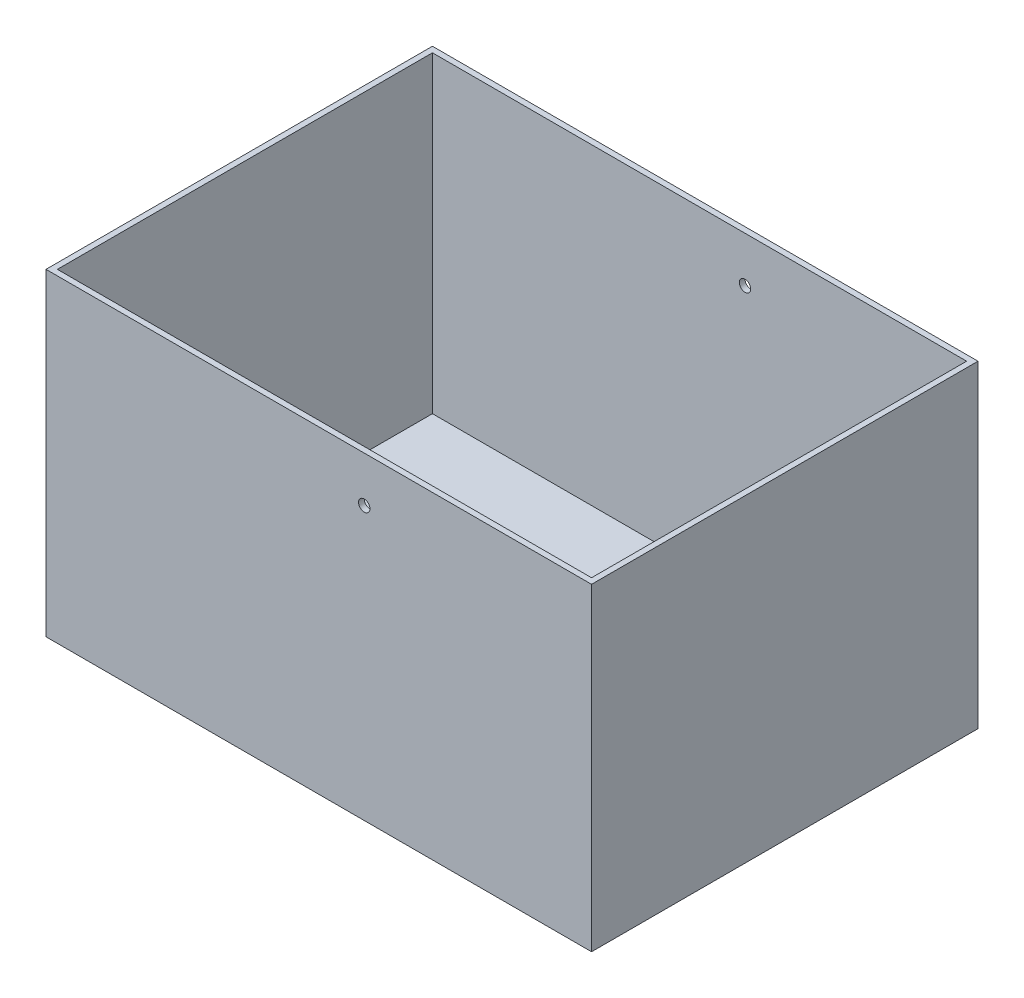
from build123d import *

# Parameters (mm, degrees)
SKETCH1_W               = 298.45
SKETCH1_H               = 209.55
BOSS_EXTRUDE1_DEPTH     = 3.175
SKETCH1_3_W             = 304.8
SKETCH1_3_H             = 215.9
SKETCH1_3_W_2           = 298.45
SKETCH1_3_H_2           = 209.55
BOSS_EXTRUDE2_DEPTH     = 177.8
CUT_EXTRUDE1_DEPTH      = 319.514379581
CUT_EXTRUDE1_DEPTH_BACK = 319.514379581
SKETCH2_R               = 3.175


with BuildPart() as part:
    # Sketch1 → Boss-Extrude1 (new body)
    with BuildSketch(Plane(origin=(0, 0, 0), x_dir=(1, 0, 0), z_dir=(0, 1, 0))):
        Rectangle(SKETCH1_W, SKETCH1_H)
    extrude(amount=BOSS_EXTRUDE1_DEPTH)

    # Sketch1<3> → Boss-Extrude2 (add)
    with BuildSketch(Plane(origin=(0, 0, 0), x_dir=(1, 0, 0), z_dir=(0, 1, 0))):
        Rectangle(SKETCH1_3_W, SKETCH1_3_H)
        Rectangle(SKETCH1_3_W_2, SKETCH1_3_H_2, mode=Mode.SUBTRACT)
    extrude(amount=BOSS_EXTRUDE2_DEPTH)

    # Sketch2 → Cut-Extrude1 (cut, two sides: drawn at the far end of the back side and taken through both)
    with BuildSketch(Plane.XY.offset(107.95).offset(-CUT_EXTRUDE1_DEPTH_BACK)):
        with Locations((25.4, 152.4)):
            Circle(SKETCH2_R)
    extrude(amount=CUT_EXTRUDE1_DEPTH + CUT_EXTRUDE1_DEPTH_BACK, mode=Mode.SUBTRACT)


solid = part.part
